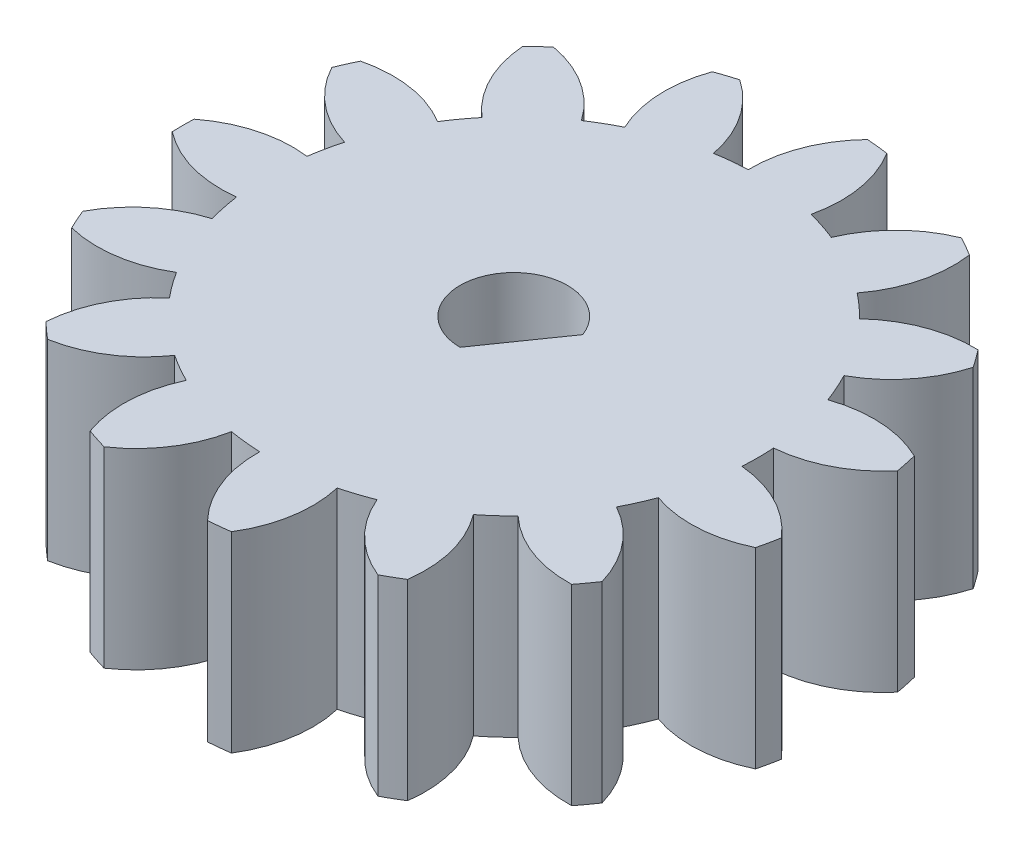
from build123d import *

# Parameters (mm, degrees)
SKETCH1_R           = 56.531668112
BOSS_EXTRUDE1_DEPTH = 5
SKETCH2_R           = 93.360470672
CUT_EXTRUDE1_DEPTH  = 83.481553238
CUT_EXTRUDE2_DEPTH  = 93.989824493


with BuildPart() as part:
    # Sketch1 → Boss-Extrude1 (new body)
    with BuildSketch(Plane(origin=(0, 0, 0), x_dir=(1, 0, 0), z_dir=(0, 1, 0))):
        Circle(SKETCH1_R)
    extrude(amount=BOSS_EXTRUDE1_DEPTH)

    # Sketch2 → Cut-Extrude1 (cut, through all)
    with BuildSketch(Plane(origin=(0.053951493, 9.696123263, -2.690451675), x_dir=(0, 0, 1), z_dir=(0, 1, 0))):
        with Locations((2.690451675, -0.053951493)):
            Circle(SKETCH2_R)
        with BuildLine():
            ThreePointArc((7.987976033, 6.754966533), (7.789005891, 5.548363877), (7.142485611, 4.510341424))
            ThreePointArc((7.142485611, 4.510341424), (7.428743082, 4.212425253), (7.695105184, 3.89659521))
            ThreePointArc((7.695105184, 3.89659521), (8.795021012, 4.431070894), (10.015811815, 4.502826734))
            ThreePointArc((10.015811815, 4.502826734), (10.161652833, 4.259548507), (10.299417449, 4.011607367))
            ThreePointArc((10.299417449, 4.011607367), (9.626879667, 2.990249439), (8.614052233, 2.304932231))
            ThreePointArc((8.614052233, 2.304932231), (8.754388023, 1.916340863), (8.869262259, 1.519476535))
            ThreePointArc((8.869262259, 1.519476535), (10.091476214, 1.560368296), (11.235909836, 1.129380165))
            ThreePointArc((11.235909836, 1.129380165), (11.270192066, 0.84781556), (11.295199558, 0.56527614))
            ThreePointArc((11.295199558, 0.56527614), (10.265382027, -0.094234996), (9.061374505, -0.308349388))
            ThreePointArc((9.061374505, -0.308349388), (9.03152328, -0.720424975), (8.975046852, -1.12970214))
            ThreePointArc((8.975046852, -1.12970214), (10.108227036, -1.589464859), (10.978420508, -2.448675198))
            ThreePointArc((10.978420508, -2.448675198), (10.895216241, -2.719841104), (10.803142587, -2.98812517))
            ThreePointArc((10.803142587, -2.98812517), (9.594110113, -3.171754047), (8.407106342, -2.8776433))
            ThreePointArc((8.407106342, -2.8776433), (8.212229649, -3.241951493), (7.994167845, -3.592873756))
            ThreePointArc((7.994167845, -3.592873756), (8.84237711, -4.473793803), (9.287866075, -5.612661077))
            ThreePointArc((9.287866075, -5.612661077), (9.101562084, -5.826541234), (8.908327655, -6.034181196))
            ThreePointArc((8.908327655, -6.034181196), (7.729132938, -5.710176712), (6.764376652, -4.958695246))
            ThreePointArc((6.764376652, -4.958695246), (6.438170443, -5.212243849), (6.09622813, -5.444133562))
            ThreePointArc((6.09622813, -5.444133562), (6.512803388, -6.593891859), (6.456558756, -7.81549557))
            ThreePointArc((6.456558756, -7.81549557), (6.199368695, -7.935108156), (5.938385479, -8.046201177))
            ThreePointArc((5.938385479, -8.046201177), (4.992921997, -7.270586652), (4.417228324, -6.191672439))
            ThreePointArc((4.417228324, -6.191672439), (4.016096616, -6.290620595), (3.609398725, -6.363381921))
            ThreePointArc((3.609398725, -6.363381921), (3.52231033, -7.583174812), (2.974057309, -8.67628858))
            ThreePointArc((2.974057309, -8.67628858), (2.690451675, -8.680951493), (2.406846041, -8.67628858))
            ThreePointArc((2.406846041, -8.67628858), (1.85859302, -7.583174812), (1.771504625, -6.363381921))
            ThreePointArc((1.771504625, -6.363381921), (1.364806734, -6.290620595), (0.963675026, -6.191672439))
            ThreePointArc((0.963675026, -6.191672439), (0.387981353, -7.270586652), (-0.557482129, -8.046201177))
            ThreePointArc((-0.557482129, -8.046201177), (-0.818465345, -7.935108156), (-1.075655406, -7.81549557))
            ThreePointArc((-1.075655406, -7.81549557), (-1.131900038, -6.593891859), (-0.71532478, -5.444133562))
            ThreePointArc((-0.71532478, -5.444133562), (-1.057267094, -5.212243849), (-1.383473303, -4.958695246))
            ThreePointArc((-1.383473303, -4.958695246), (-2.348229588, -5.710176712), (-3.527424305, -6.034181196))
            ThreePointArc((-3.527424305, -6.034181196), (-3.720658735, -5.826541234), (-3.906962725, -5.612661077))
            ThreePointArc((-3.906962725, -5.612661077), (-3.46147376, -4.473793803), (-2.613264496, -3.592873756))
            ThreePointArc((-2.613264496, -3.592873756), (-2.8313263, -3.241951493), (-3.026202992, -2.8776433))
            ThreePointArc((-3.026202992, -2.8776433), (-4.213206764, -3.171754047), (-5.422239237, -2.98812517))
            ThreePointArc((-5.422239237, -2.98812517), (-5.514312891, -2.719841104), (-5.597517158, -2.448675198))
            ThreePointArc((-5.597517158, -2.448675198), (-4.727323686, -1.589464859), (-3.594143503, -1.12970214))
            ThreePointArc((-3.594143503, -1.12970214), (-3.65061993, -0.720424975), (-3.680471156, -0.308349388))
            ThreePointArc((-3.680471156, -0.308349388), (-4.884478677, -0.094234996), (-5.914296209, 0.56527614))
            ThreePointArc((-5.914296209, 0.56527614), (-5.889288716, 0.84781556), (-5.855006486, 1.129380165))
            ThreePointArc((-5.855006486, 1.129380165), (-4.710572864, 1.560368296), (-3.48835891, 1.519476535))
            ThreePointArc((-3.48835891, 1.519476535), (-3.373484673, 1.916340863), (-3.233148884, 2.304932231))
            ThreePointArc((-3.233148884, 2.304932231), (-4.245976317, 2.990249439), (-4.9185141, 4.011607367))
            ThreePointArc((-4.9185141, 4.011607367), (-4.780749484, 4.259548507), (-4.634908466, 4.502826734))
            ThreePointArc((-4.634908466, 4.502826734), (-3.414117662, 4.431070894), (-2.314201834, 3.89659521))
            ThreePointArc((-2.314201834, 3.89659521), (-2.047839732, 4.212425253), (-1.761582261, 4.510341424))
            ThreePointArc((-1.761582261, 4.510341424), (-2.408102542, 5.548363877), (-2.607072683, 6.754966533))
            ThreePointArc((-2.607072683, 6.754966533), (-2.380371697, 6.925438117), (-2.148189128, 7.088364951))
            ThreePointArc((-2.148189128, 7.088364951), (-1.062126964, 6.526272375), (-0.274694701, 5.590628471))
            ThreePointArc((-0.274694701, 5.590628471), (0.097098839, 5.770814345), (0.479781475, 5.926542907))
            ThreePointArc((0.479781475, 5.926542907), (0.311357577, 7.137787092), (0.620358822, 8.321001915))
            ThreePointArc((0.620358822, 8.321001915), (0.896797518, 8.384527858), (1.175175163, 8.438931768))
            ThreePointArc((1.175175163, 8.438931768), (1.938718671, 7.483693371), (2.277513178, 6.308662576))
            ThreePointArc((2.277513178, 6.308662576), (2.690451675, 6.322048507), (3.103390171, 6.308662576))
            ThreePointArc((3.103390171, 6.308662576), (3.442184678, 7.483693371), (4.205728187, 8.438931768))
            ThreePointArc((4.205728187, 8.438931768), (4.484105832, 8.384527858), (4.760544528, 8.321001915))
            ThreePointArc((4.760544528, 8.321001915), (5.069545773, 7.137787092), (4.901121875, 5.926542907))
            ThreePointArc((4.901121875, 5.926542907), (5.283804511, 5.770814345), (5.65559805, 5.590628471))
            ThreePointArc((5.65559805, 5.590628471), (6.443030314, 6.526272375), (7.529092477, 7.088364951))
            ThreePointArc((7.529092477, 7.088364951), (7.761275046, 6.925438117), (7.987976033, 6.754966533))
        make_face(mode=Mode.SUBTRACT)
    extrude(amount=-CUT_EXTRUDE1_DEPTH, mode=Mode.SUBTRACT)

    # Sketch4 → Cut-Extrude2 (cut, through all)
    with BuildSketch(Plane(origin=(64.693992366, 5.1354, -48.358110231), x_dir=(1, 0, 0), z_dir=(0, 1, 0))):
        with BuildLine():
            Line((-64.693992366, -49.758110231), (-63.380949475, -47.872395945))
            ThreePointArc((-63.380949475, -47.872395945), (-65.842904895, -47.558110231), (-64.693992366, -49.758110231))
        make_face()
    extrude(amount=-CUT_EXTRUDE2_DEPTH, mode=Mode.SUBTRACT)


solid = part.part
